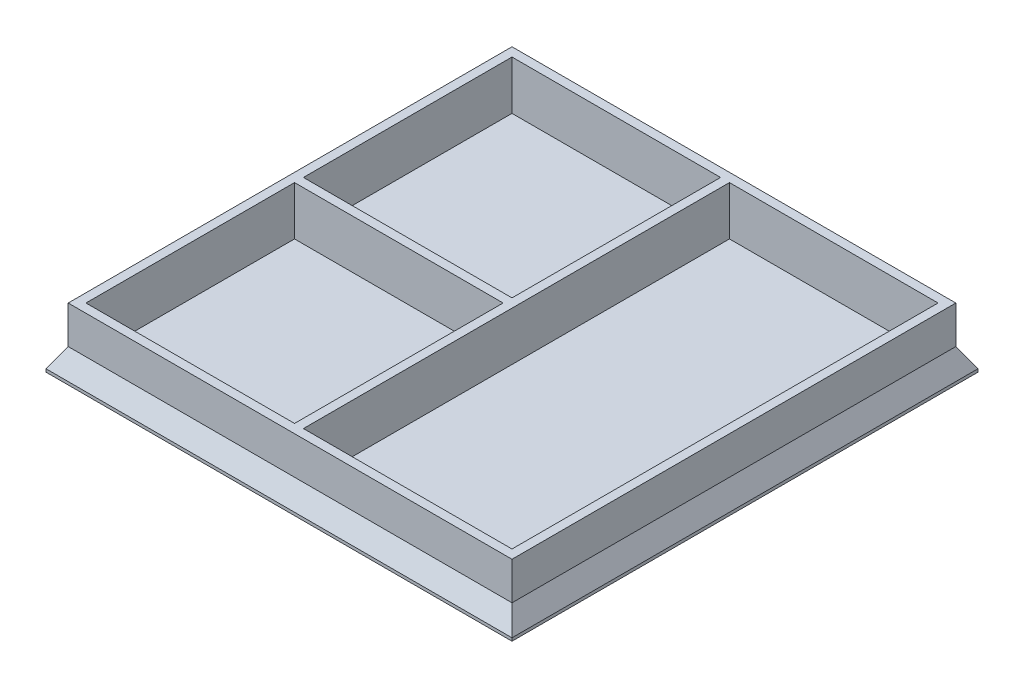
from build123d import *
from OCP.BRepFilletAPI import BRepFilletAPI_MakeChamfer

# Parameters (mm, degrees)
SKICA1_W                = 84
SKICA1_H                = 84
P_IDAT_VYSUNUT_M1_DEPTH = 2
SKICA1_3_W              = 80
SKICA1_3_H              = 80
SKICA1_3_W_2            = 37.6
SKICA1_3_H_2            = 76.8
SKICA1_3_H_3            = 37.6
P_IDAT_VYSUNUT_M2_DEPTH = 10.8
SKICA1_4_W              = 84
SKICA1_4_H              = 84
SKICA1_4_W_2            = 80
SKICA1_4_H_2            = 80
P_IDAT_VYSUNUT_M3_DEPTH = 4
ZKOSEN_2_SIZE           = 3.464101615
ZKOSEN_2_SIZE_2         = 2


with BuildPart() as part:
    # Skica1 → Přidat vysunutím1 (new body)
    with BuildSketch(Plane(origin=(0, 0, 0), x_dir=(1, 0, 0), z_dir=(0, 1, 0))):
        with Locations((-42, 42)):
            Rectangle(SKICA1_W, SKICA1_H)
    extrude(amount=P_IDAT_VYSUNUT_M1_DEPTH)

    # Skica1<3> → Přidat vysunutím2 (add)
    with BuildSketch(Plane(origin=(0, 0, 0), x_dir=(1, 0, 0), z_dir=(0, 1, 0))):
        with Locations((-42, 42)):
            Rectangle(SKICA1_3_W, SKICA1_3_H)
        with Locations((-22.4, 42)):
            Rectangle(SKICA1_3_W_2, SKICA1_3_H_2, mode=Mode.SUBTRACT)
        with Locations((-61.6, 61.6)):
            Rectangle(SKICA1_3_W_2, SKICA1_3_H_3, mode=Mode.SUBTRACT)
        with Locations((-61.6, 22.4)):
            Rectangle(SKICA1_3_W_2, SKICA1_3_H_3, mode=Mode.SUBTRACT)
    extrude(amount=P_IDAT_VYSUNUT_M2_DEPTH)

    # Skica1<4> → Přidat vysunutím3 (add)
    with BuildSketch(Plane(origin=(0, 0, 0), x_dir=(1, 0, 0), z_dir=(0, 1, 0))):
        with Locations((-42, 42)):
            Rectangle(SKICA1_4_W, SKICA1_4_H)
        with Locations((-42, 42)):
            Rectangle(SKICA1_4_W_2, SKICA1_4_H_2, mode=Mode.SUBTRACT)
    extrude(amount=P_IDAT_VYSUNUT_M3_DEPTH)

    # Zkosení2
    zkosen_2_edges_1 = [part.edges().sort_by_distance(p)[0] for p in [
        (-84, 4, -42),
    ]]
    zkosen_2_side_1 = [part.faces().sort_by_distance(p)[0] for p in [
        (-84, 3.96, -42),
    ]]
    zkosen_2_edges_2 = [part.edges().sort_by_distance(p)[0] for p in [
        (-42, 4, 0),
    ]]
    zkosen_2_side_2 = [part.faces().sort_by_distance(p)[0] for p in [
        (-42, 3.96, 0),
    ]]
    zkosen_2_edges_3 = [part.edges().sort_by_distance(p)[0] for p in [
        (0, 4, -42),
    ]]
    zkosen_2_side_3 = [part.faces().sort_by_distance(p)[0] for p in [
        (-0.04, 4, -42),
    ]]
    zkosen_2_edges_4 = [part.edges().sort_by_distance(p)[0] for p in [
        (-42, 4, -84),
    ]]
    zkosen_2_side_4 = [part.faces().sort_by_distance(p)[0] for p in [
        (-42, 3.96, -84),
    ]]
    zkosen_2 = BRepFilletAPI_MakeChamfer(part.part.solid().wrapped)
    for e in zkosen_2_edges_1:
        zkosen_2.Add(ZKOSEN_2_SIZE - 0.0001, ZKOSEN_2_SIZE_2 - 0.0001, e.wrapped, zkosen_2_side_1[0].wrapped)
    for e in zkosen_2_edges_2:
        zkosen_2.Add(ZKOSEN_2_SIZE - 0.0001, ZKOSEN_2_SIZE_2 - 0.0001, e.wrapped, zkosen_2_side_2[0].wrapped)
    for e in zkosen_2_edges_3:
        zkosen_2.Add(ZKOSEN_2_SIZE_2 - 0.0001, ZKOSEN_2_SIZE - 0.0001, e.wrapped, zkosen_2_side_3[0].wrapped)
    for e in zkosen_2_edges_4:
        zkosen_2.Add(ZKOSEN_2_SIZE - 0.0001, ZKOSEN_2_SIZE_2 - 0.0001, e.wrapped, zkosen_2_side_4[0].wrapped)
    add(Compound.cast(zkosen_2.Shape()), mode=Mode.REPLACE)  # a hair under: the kernel refuses the full size


solid = part.part
